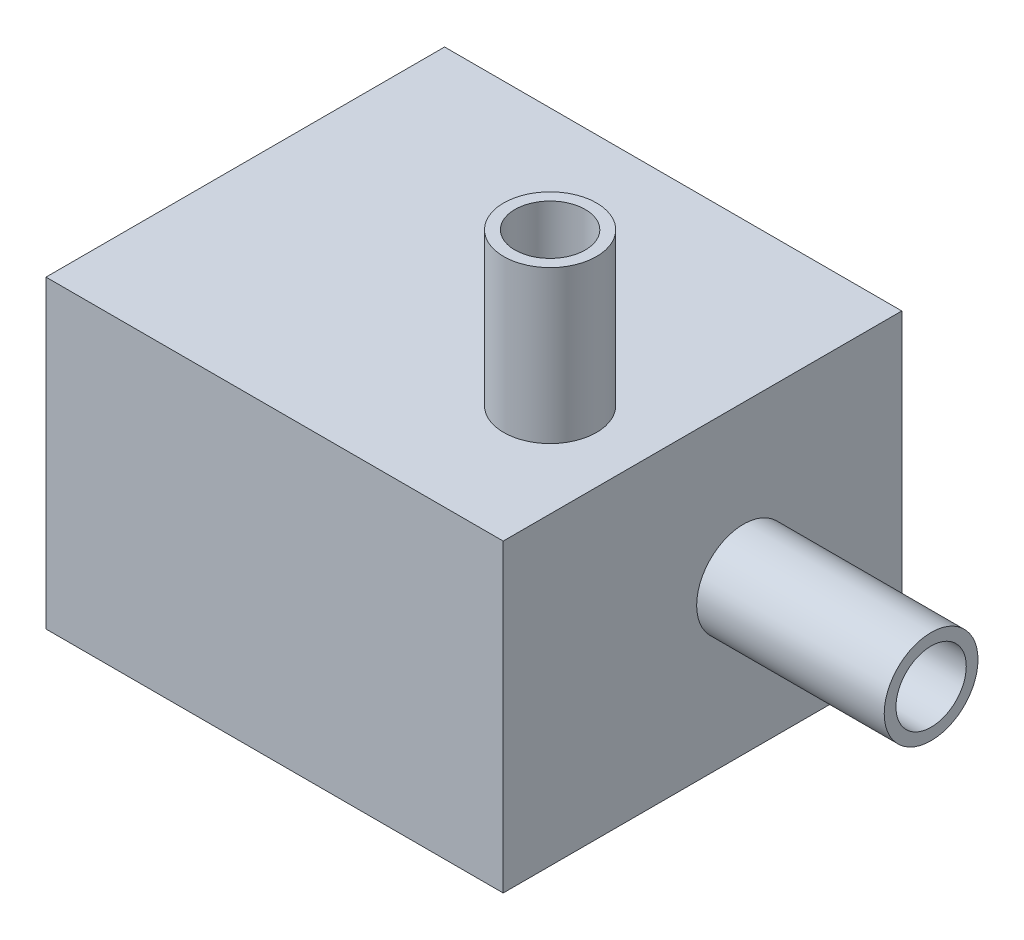
from build123d import *

# Parameters (mm, degrees)
SKETCH1_W           = 39
SKETCH1_H           = 34
BOSS_EXTRUDE1_DEPTH = 26
SKETCH2_R           = 3.960191442
BOSS_EXTRUDE2_DEPTH = 13
SKETCH3_R           = 3
CUT_EXTRUDE1_DEPTH  = 13
SKETCH4_R           = 4
BOSS_EXTRUDE3_DEPTH = 16
SKETCH5_R           = 3
CUT_EXTRUDE2_DEPTH  = 16


with BuildPart() as part:
    # Sketch1 → Boss-Extrude1 (new body)
    with BuildSketch(Plane(origin=(0, 0, 0), x_dir=(1, 0, 0), z_dir=(0, 1, 0))):
        Rectangle(SKETCH1_W, SKETCH1_H)
    extrude(amount=BOSS_EXTRUDE1_DEPTH)

    # Sketch2 → Boss-Extrude2 (add)
    with BuildSketch(Plane(origin=(0, 26, 0), x_dir=(1, 0, 0), z_dir=(0, 1, 0))):
        with Locations((11.5, -5)):
            Circle(SKETCH2_R)
    extrude(amount=BOSS_EXTRUDE2_DEPTH)

    # Sketch3 → Cut-Extrude1 (cut)
    with BuildSketch(Plane(origin=(0, 39, 0), x_dir=(1, 0, 0), z_dir=(0, 1, 0))):
        with Locations((11.5, -5)):
            Circle(SKETCH3_R)
    extrude(amount=-CUT_EXTRUDE1_DEPTH, mode=Mode.SUBTRACT)

    # Sketch4 → Boss-Extrude3 (add)
    with BuildSketch(Plane(origin=(19.5, 0, 0), x_dir=(0, 0, -1), z_dir=(1, 0, 0))):
        with Locations((3.5, 13)):
            Circle(SKETCH4_R)
    extrude(amount=BOSS_EXTRUDE3_DEPTH)

    # Sketch5 → Cut-Extrude2 (cut)
    with BuildSketch(Plane(origin=(35.5, 0, 0), x_dir=(0, 0, -1), z_dir=(1, 0, 0))):
        with Locations((3.5, 13)):
            Circle(SKETCH5_R)
    extrude(amount=-CUT_EXTRUDE2_DEPTH, mode=Mode.SUBTRACT)


solid = part.part
